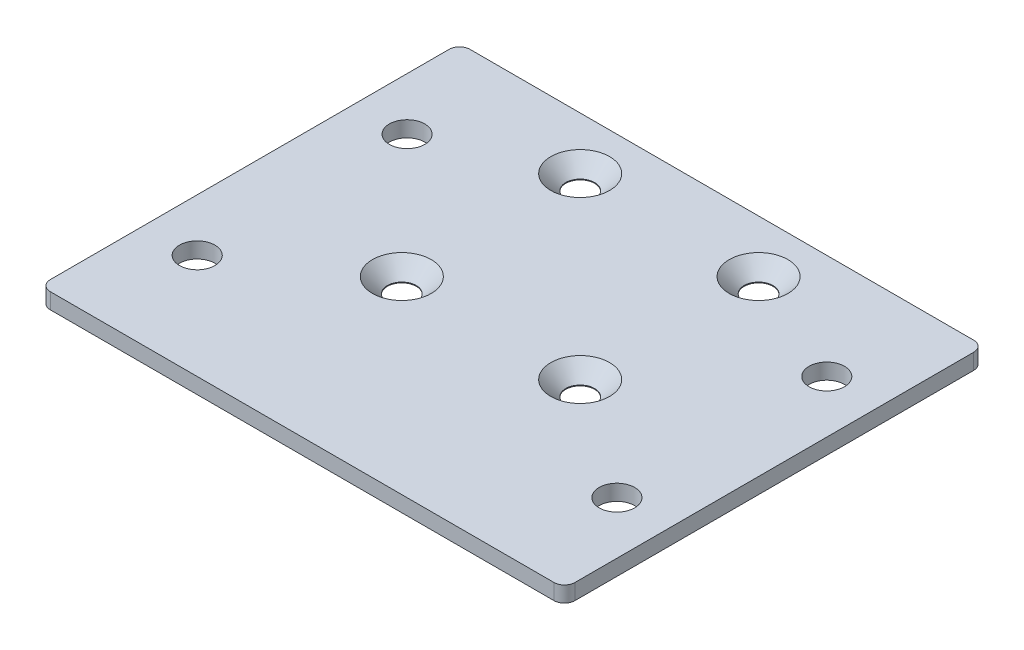
from build123d import *

# Parameters (mm, degrees)
CROQUIS1_W                                   = 100
CROQUIS1_H                                   = 80
BRIDA_BASE1_DEPTH                            = 3
REDONDEO1_R                                  = 2
TALADRO_DE_MARGEN_PARA_1_41_D                = 6.7564
REFRENTADO_PARA_TORNILLO_TAP_N_CON_C_2_COUNT = 2
REFRENTADO_PARA_TORNILLO_TAP_N_CON_C_2_PITCH = 34
REFRENTADO_PARA_TORNILLO_TAP_N_CON_C_3_COUNT = 2
REFRENTADO_PARA_TORNILLO_TAP_N_CON_C_3_PITCH = 48.083261121
REFRENTADO_PARA_TORNILLO_TAP_N_CON_C_4_COUNT = 2
REFRENTADO_PARA_TORNILLO_TAP_N_CON_C_4_PITCH = 34


# Sheet-metal steps are written as plain solids
with BuildPart() as part:
    # Croquis1 → Brida base1 (new body)
    with BuildSketch(Plane(origin=(0, 0, 0), x_dir=(1, 0, 0), z_dir=(0, 1, 0))):
        with Locations((-99.777777778, -5.555555556)):
            Rectangle(CROQUIS1_W, CROQUIS1_H)
    extrude(amount=-BRIDA_BASE1_DEPTH)

    # Redondeo1
    redondeo1_edges = [part.edges().sort_by_distance(p)[0] for p in [
        (-149.777777778, -1.5, -34.444444444),
        (-49.777777778, -1.5, -34.444444444),
        (-49.777777778, -1.5, 45.555555556),
        (-149.777777778, -1.5, 45.555555556),
    ]]
    fillet(redondeo1_edges, radius=REDONDEO1_R)

    # Taladro de margen para 1/41 (through all)
    with Locations(Plane(origin=(0, 0, 0), x_dir=(1, 0, 0), z_dir=(0, 1, 0))):
        with Locations((-139.777777778, -25.555555556), (-59.777777778, -25.555555556), (-139.777777778, 14.444444444), (-59.777777778, 14.444444444)):
            Hole(TALADRO_DE_MARGEN_PARA_1_41_D / 2)

    # Croquis9 → Refrentado para tornillo tapón con cabeza plana de clavija de M51 (revolve, cut)
    with BuildSketch(Plane(origin=(-116.777777778, 0, -24.444444444), x_dir=(0, 0, 1), z_dir=(1, 0, 0))):
        Polygon((0, 0), (0, 3), (2.75, 3), (2.75, 2.85), (5.6, 0), align=None)
    refrentado_para_tornillo_tap_n_con_cabez = revolve(axis=Axis((-116.777777778, 6.35, -24.444444444), (0, -1, 0)), mode=Mode.SUBTRACT)

    # Refrentado para tornillo tap_n con c 2: Refrentado para tornillo tapón con cabeza plana de clavija de M51 ×2
    with Locations(*[(i * REFRENTADO_PARA_TORNILLO_TAP_N_CON_C_2_PITCH, 0, 0) for i in range(1, REFRENTADO_PARA_TORNILLO_TAP_N_CON_C_2_COUNT)]):
        add(refrentado_para_tornillo_tap_n_con_cabez, mode=Mode.SUBTRACT)

    # Refrentado para tornillo tap_n con c 3: Refrentado para tornillo tapón con cabeza plana de clavija de M51 ×2
    with Locations(*[Vector(0.7071067811865476, 0, 0.7071067811865476) * (i * REFRENTADO_PARA_TORNILLO_TAP_N_CON_C_3_PITCH) for i in range(1, REFRENTADO_PARA_TORNILLO_TAP_N_CON_C_3_COUNT)]):
        add(refrentado_para_tornillo_tap_n_con_cabez, mode=Mode.SUBTRACT)

    # Refrentado para tornillo tap_n con c 4: Refrentado para tornillo tapón con cabeza plana de clavija de M51 ×2
    with Locations(*[(0, 0, i * REFRENTADO_PARA_TORNILLO_TAP_N_CON_C_4_PITCH) for i in range(1, REFRENTADO_PARA_TORNILLO_TAP_N_CON_C_4_COUNT)]):
        add(refrentado_para_tornillo_tap_n_con_cabez, mode=Mode.SUBTRACT)


solid = part.part
